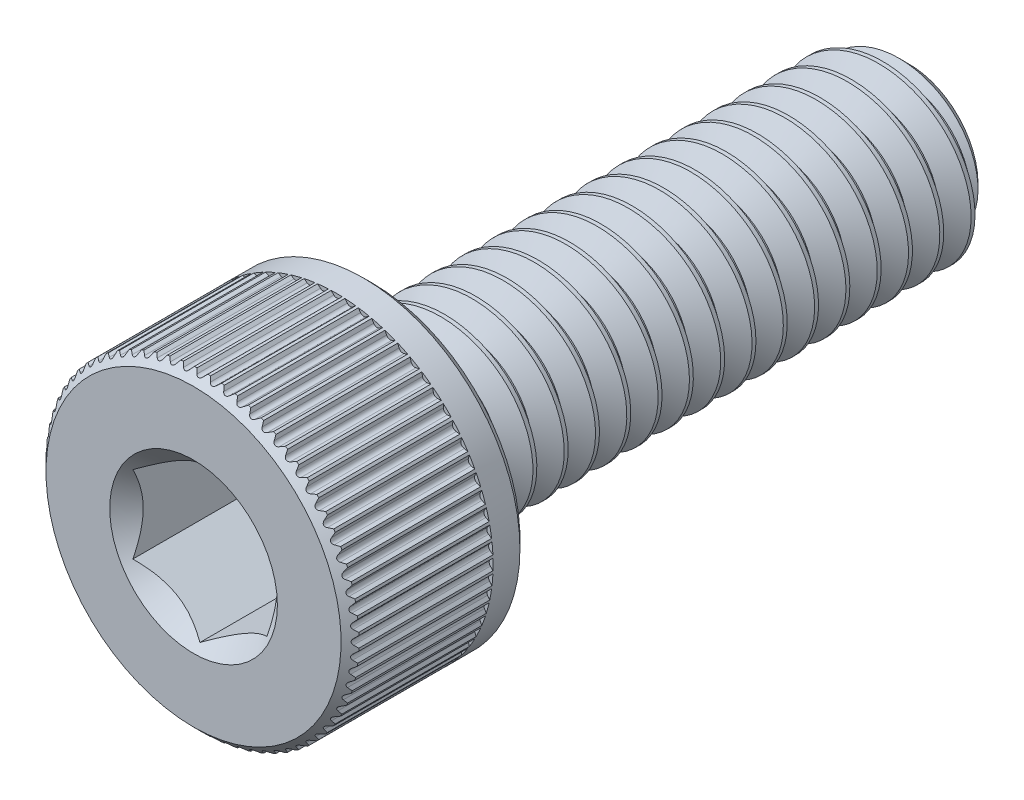
from build123d import *

# Parameters (mm, degrees)
CUT_EXTRUDE1_DEPTH     = 3
SPLIT1_SURFACE_1_BACK  = 19.815
SPLIT1_SURFACE_1_DEPTH = 39.63
SPLIT1_SURFACE_2_BACK  = 19.815
SPLIT1_SURFACE_2_DEPTH = 39.63
CUT_SWEEP1_PITCH       = 0.7
CUT_SWEEP1_TO          = 11.8
CUT_EXTRUDE3_DEPTH     = 3.2
CIRPATTERN1_COUNT      = 72


with BuildPart() as part:
    # Sketch2 → Revolve1 (revolve)
    with BuildSketch(Plane(origin=(0, 0, 0), x_dir=(0, 0, -1), z_dir=(1, 0, 0))):
        with BuildLine():
            Line((-8, 0), (-8, 3.3))
            Line((-8, 3.3), (-7.8, 3.5))
            Line((-7.8, 3.5), (-4.2, 3.5))
            Line((-4.2, 3.5), (-4, 3.3))
            Line((-4, 3.3), (-4, 2.2))
            ThreePointArc((-4, 2.2), (-3.941421356, 2.058578644), (-3.8, 2))
            Line((-3.8, 2), (7.545336663, 2))
            Line((7.545336663, 2), (8, 1.545336663))
            Line((8, 1.545336663), (8, 0))
            Line((8, 0), (-8, 0))
        make_face()
    revolve(axis=Axis((0, 0, -8), (0, 0, 1)))

    # Sketch3 → Cut-Extrude1 (cut)
    with BuildSketch(Plane.XY.offset(8)):
        Polygon((1.5, -0.866025404), (1.5, 0.866025404), (0, 1.732050808), (-1.5, 0.866025404), (-1.5, -0.866025404), (0, -1.732050808), align=None)
    extrude(amount=-CUT_EXTRUDE1_DEPTH, mode=Mode.SUBTRACT)

    # Cut-Extrude2 cone 1 section (through the dimple's axis) → Cut-Extrude2 (revolve, cut)
    with BuildSketch(Plane(origin=(0, 0, 8), x_dir=(0, -1, 0), z_dir=(1, 0, 0))):
        Polygon((0, 0), (1.875, 0), (0, 1.875), align=None)
    revolve(axis=Axis((0, 0, 8), (0, 0, -1)), mode=Mode.SUBTRACT)


with BuildPart() as body_2:
    # Split1: the piece behind the surface
    add(part.part)
    # Split1 surface: a surface, the sketch's curves swept straight by 39.63 mm
    with BuildLine(Plane(origin=(0, 0, 0), x_dir=(0, 0, -1), z_dir=(1, 0, 0)).offset(-SPLIT1_SURFACE_1_BACK), mode=Mode.PRIVATE) as split1_surface_1_path:
        Line((-3.8, -3.5), (-3.8, 3.5))
    split1_surface_1 = Shell.extrude(split1_surface_1_path.wire(), (1 * SPLIT1_SURFACE_1_DEPTH, 0 * SPLIT1_SURFACE_1_DEPTH, 0 * SPLIT1_SURFACE_1_DEPTH))
    split(bisect_by=split1_surface_1, keep=Keep.BOTTOM)

    # Cut-Sweep1: arcs per turn and ends read off the stored shape
    # Cut-Sweep1: the profile of Sketch7 screwed along a right-hand helix through 18.142857 turns, 6 arcs to a turn; built about Z, then put on its axis
    cut_sweep1_z = Axis((0, 0, 0), (0, 0, 1))
    cut_sweep1_corners = [(2.037888611, 0, 0.021875), (2.037888611, 0, -0.634375), (1.545336663, 0, -0.35), (1.545336663, 0, -0.2625)]
    with BuildLine(mode=Mode.PRIVATE) as cut_sweep1_profile:
        Line(cut_sweep1_corners[0], cut_sweep1_corners[1])
        Line(cut_sweep1_corners[1], cut_sweep1_corners[2])
        Line(cut_sweep1_corners[2], cut_sweep1_corners[3])
        Line(cut_sweep1_corners[3], cut_sweep1_corners[0])
    cut_sweep1_cap = Face(cut_sweep1_profile.wire())
    cut_sweep1_turn_angles = [0, 30, 60, 90, 120, 150, 180, 210, 240, 270, 300, 330, 360]
    cut_sweep1_turn_weights = [1, 0.8660254037844387, 1, 0.8660254037844387, 1, 0.8660254037844387, 1, 0.8660254037844387, 1, 0.8660254037844387, 1, 0.8660254037844387, 1]
    cut_sweep1_turn_rails = [Edge.make_bspline([Vector(p[0], p[1], 0).rotate(cut_sweep1_z, cut_sweep1_turn_angles[k]) / cut_sweep1_turn_weights[k] + Vector(0, 0, p[2] + CUT_SWEEP1_PITCH * cut_sweep1_turn_angles[k] / 360) for k in range(13)], [0, 0, 0, 1, 1, 2, 2, 3, 3, 4, 4, 5, 5, 6, 6, 6], 2, cut_sweep1_turn_weights) for p in cut_sweep1_corners]
    cut_sweep1_turn_sides = [Face.make_surface_from_curves(cut_sweep1_turn_rails[p[0]], cut_sweep1_turn_rails[p[1]]) for p in [(0, 1), (1, 2), (2, 3), (3, 0)]]
    cut_sweep1_last_angles = [6480, 6505.714285714, 6531.428571429]
    cut_sweep1_last_weights = [1, 0.9009688679026391, 1]
    cut_sweep1_last_rails = [Edge.make_bspline([Vector(p[0], p[1], 0).rotate(cut_sweep1_z, cut_sweep1_last_angles[k]) / cut_sweep1_last_weights[k] + Vector(0, 0, p[2] + CUT_SWEEP1_PITCH * cut_sweep1_last_angles[k] / 360) for k in range(3)], [0, 0, 0, 1, 1, 1], 2, cut_sweep1_last_weights) for p in cut_sweep1_corners]
    cut_sweep1_last_sides = [Face.make_surface_from_curves(cut_sweep1_last_rails[p[0]], cut_sweep1_last_rails[p[1]]) for p in [(0, 1), (1, 2), (2, 3), (3, 0)]]
    cut_sweep1 = Plane(origin=(0, 0, -8), x_dir=(0, 1, 0), z_dir=(0, 0, 1)) * split(Solid(Shell([*[p.moved(Location((0, 0, CUT_SWEEP1_PITCH * i))) for i in range(18) for p in cut_sweep1_turn_sides], *cut_sweep1_last_sides, cut_sweep1_cap, cut_sweep1_cap.rotate(cut_sweep1_z, 6531.428571429).moved(Location((0, 0, CUT_SWEEP1_PITCH * 6531.428571429 / 360)))])), bisect_by=Plane.XY.offset(CUT_SWEEP1_TO), keep=Keep.BOTTOM, mode=Mode.PRIVATE)
    add(cut_sweep1, mode=Mode.SUBTRACT)


with BuildPart() as part_1:
    add(part.part)

    # Split1: split by a surface, the side it looks to stays
    # Split1 surface: a surface, the sketch's curves swept straight by 39.63 mm
    with BuildLine(Plane(origin=(0, 0, 0), x_dir=(0, 0, -1), z_dir=(1, 0, 0)).offset(-SPLIT1_SURFACE_2_BACK), mode=Mode.PRIVATE) as split1_surface_2_path:
        Line((-3.8, -3.5), (-3.8, 3.5))
    split1_surface_2 = Shell.extrude(split1_surface_2_path.wire(), (1 * SPLIT1_SURFACE_2_DEPTH, 0 * SPLIT1_SURFACE_2_DEPTH, 0 * SPLIT1_SURFACE_2_DEPTH))
    split(bisect_by=split1_surface_2, keep=Keep.TOP)

    add(body_2.part)  # Revolve2 merges body 2
    # Sketch8 → Revolve2 (revolve)
    with BuildSketch(Plane(origin=(0, 0, 0), x_dir=(0, 0, -1), z_dir=(1, 0, 0)), mode=Mode.PRIVATE) as revolve2_sk:
        Polygon((-4, 0), (-4, 2), (-3.8, 2), (-2.645299462, 0), align=None)
    revolve(revolve2_sk.sketch.rotate(Axis((0, 0, 2.645299462), (0, 0, 1)), 270), axis=Axis((0, 0, 2.645299462), (0, 0, 1)))

    # Sketch12 → Cut-Extrude3 (cut)
    with BuildSketch(Plane.XY.offset(8)):
        with BuildLine():
            Line((-0.211780344, 3.5875), (0.211780344, 3.5875))
            Line((0.211780344, 3.5875), (0.062787974, 3.438507631))
            ThreePointArc((0.062787974, 3.438507631), (0, 3.4125), (-0.062787974, 3.438507631))
            Line((-0.062787974, 3.438507631), (-0.211780344, 3.5875))
        make_face()
    cut_extrude3 = extrude(amount=-CUT_EXTRUDE3_DEPTH, mode=Mode.SUBTRACT)

    # CirPattern1: Cut-Extrude3 ×72 about axis
    cirpattern1_axis = Axis((0, 0, 0), (0, 0, 1))
    for i in range(1, CIRPATTERN1_COUNT):
        add(cut_extrude3.rotate(cirpattern1_axis, i * 360 / CIRPATTERN1_COUNT), mode=Mode.SUBTRACT)


solid = part_1.part
